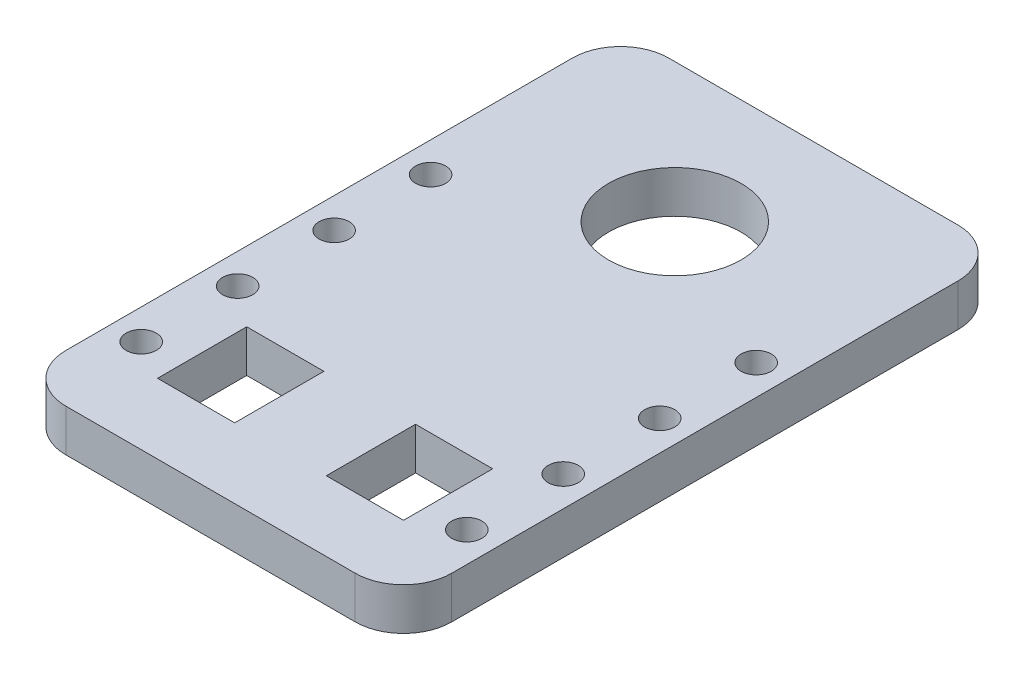
from build123d import *

# Parameters (mm, degrees)
SKETCH1_W           = 32
SKETCH1_H           = 50
SKETCH1_R           = 5.5
SKETCH1_R_2         = 1.25
BOSS_EXTRUDE1_DEPTH = 3.5
FILETE1_R           = 4


with BuildPart() as part:
    # Sketch1 → Boss-Extrude1 (new body)
    with BuildSketch(Plane(origin=(0, 0, 0), x_dir=(1, 0, 0), z_dir=(0, 1, 0))):
        Rectangle(SKETCH1_W, SKETCH1_H)
        with Locations((0, 13.5)):
            Circle(SKETCH1_R, mode=Mode.SUBTRACT)
        with Locations((13.5, 6.75)):
            Circle(SKETCH1_R_2, mode=Mode.SUBTRACT)
        with Locations((13.5, -1.25)):
            Circle(SKETCH1_R_2, mode=Mode.SUBTRACT)
        with Locations((13.5, -9.25)):
            Circle(SKETCH1_R_2, mode=Mode.SUBTRACT)
        with Locations((13.5, -17.25)):
            Circle(SKETCH1_R_2, mode=Mode.SUBTRACT)
        with Locations((-13.5, -17.25)):
            Circle(SKETCH1_R_2, mode=Mode.SUBTRACT)
        with Locations((-13.5, -9.25)):
            Circle(SKETCH1_R_2, mode=Mode.SUBTRACT)
        with Locations((-13.5, -1.25)):
            Circle(SKETCH1_R_2, mode=Mode.SUBTRACT)
        with Locations((-13.5, 6.75)):
            Circle(SKETCH1_R_2, mode=Mode.SUBTRACT)
        Polygon((3.8, -15.5), (3.8, -11.8), (10.2, -11.8), (10.2, -19.2), (3.8, -19.2), align=None, mode=Mode.SUBTRACT)
        Polygon((-10.2, -19.2), (-3.8, -19.2), (-3.8, -15.5), (-3.8, -11.8), (-10.2, -11.8), align=None, mode=Mode.SUBTRACT)
    extrude(amount=BOSS_EXTRUDE1_DEPTH)

    # Filete1
    filete1_edges = [part.edges().sort_by_distance(p)[0] for p in [
        (16, 1.75, 25),
        (-16, 1.75, 25),
        (-16, 1.75, -25),
        (16, 1.75, -25),
    ]]
    fillet(filete1_edges, radius=FILETE1_R)


solid = part.part
